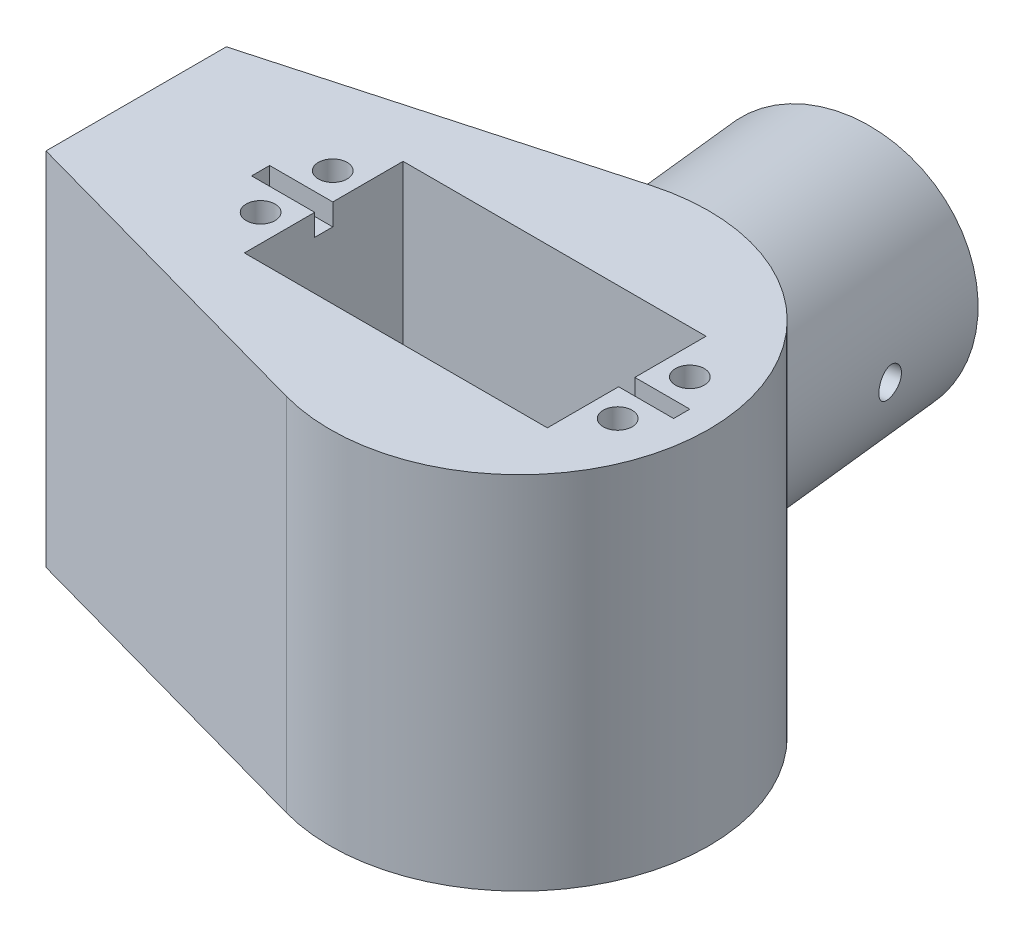
from build123d import *

# Parameters (mm, degrees)
BOSS_EXTRUDE1_DEPTH       = 40
SKETCH2_W                 = 33.6
SKETCH2_H                 = 17.6
CUT_EXTRUDE1_DEPTH        = 20
SKETCH3_W                 = 7
SKETCH3_H                 = 2
CUT_EXTRUDE2_DEPTH        = 2.4
SKETCH4_W                 = 7
SKETCH4_H                 = 1.8
CUT_EXTRUDE3_DEPTH        = 2.4
REVOLVE1_START            = -44.95139953
REVOLVE1_OUTLINE_R        = 13.5
REVOLVE1_DEPTH            = 30.829897511
M18_CLEARANCE_HOLE1_D     = 20
M18_CLEARANCE_HOLE1_DEPTH = 25
SKETCH9_W                 = 1.6
SKETCH9_H                 = 27
CUT_EXTRUDE4_DEPTH        = 76.299241718
CUT_EXTRUDE4_DEPTH_BACK   = 76.299241718
SKETCH18_R                = 1.6
SCALE2_SCALE              = 1.25
SKETCH20_R                = 9.5
CUT_EXTRUDE5_DEPTH        = 5
SKETCH21_R                = 6
CUT_EXTRUDE6_DEPTH        = 87.235197147
CUT_EXTRUDE8_START        = -6
SKETCH25_R                = 9.5
CUT_EXTRUDE8_DEPTH        = 6
SKETCH27_R                = 2
CUT_EXTRUDE9_DEPTH        = 12


with BuildPart() as part:
    # Sketch1 → Boss-Extrude1 (new body)
    with BuildSketch(Plane(origin=(0, 40, 0), x_dir=(1, 0, 0), z_dir=(0, 1, 0))):
        with BuildLine():
            Line((-5.61521172, 20.235350191), (-42.5, 10))
            Line((-42.5, 10), (-42.5, -10))
            Line((-42.5, -10), (-5.61521172, -20.235350191))
            ThreePointArc((-5.61521172, -20.235350191), (21, 0), (-5.61521172, 20.235350191))
        make_face()
    extrude(amount=-BOSS_EXTRUDE1_DEPTH)

    # Sketch2 → Cut-Extrude1 (cut)
    with BuildSketch(Plane(origin=(0, 40, 0), x_dir=(-1, 0, 0), z_dir=(0, 1, 0))):
        with Locations((4.9, 0)):
            Rectangle(SKETCH2_W, SKETCH2_H)
    extrude(amount=-CUT_EXTRUDE1_DEPTH, mode=Mode.SUBTRACT)

    # Sketch3 → Cut-Extrude2 (cut)
    with BuildSketch(Plane(origin=(0, 40, 0), x_dir=(-1, 0, 0), z_dir=(0, 1, 0))):
        with Locations((25.2, 0)):
            Rectangle(SKETCH3_W, SKETCH3_H)
    extrude(amount=-CUT_EXTRUDE2_DEPTH, mode=Mode.SUBTRACT)

    # Sketch4 → Cut-Extrude3 (cut)
    with BuildSketch(Plane(origin=(0, 40, 0), x_dir=(-1, 0, 0), z_dir=(0, 1, 0))):
        with Locations((-14.5, 0)):
            Rectangle(SKETCH4_W, SKETCH4_H)
    extrude(amount=-CUT_EXTRUDE3_DEPTH, mode=Mode.SUBTRACT)

    # Revolve1: read off the stored shape, not the designer's step
    # Revolve1 outline → Revolve1 (add)
    with BuildSketch(Plane(origin=(0, 0, 0), x_dir=(0.9799247046208294, -0.02083962380947531, -0.19827577601224947), z_dir=(0.19936793441719802, 0.10243002349202102, 0.9745565745577031)).offset(REVOLVE1_START)):
        with Locations((-1.9070974, 22.005607966)):
            Circle(REVOLVE1_OUTLINE_R)
    extrude(amount=REVOLVE1_DEPTH)

    # M18 Clearance Hole1
    with Locations(Plane(origin=(-8.961867673, -4.60437291, -43.807681948), x_dir=(-0.9799247046208296, 0.02083962380947534, 0.19827577601224922), z_dir=(-0.19936793441719777, -0.10243002349202121, -0.9745565745577032))):
        with Locations((1.9070974, 22.005607966)):
            Hole(M18_CLEARANCE_HOLE1_D / 2, depth=M18_CLEARANCE_HOLE1_DEPTH)

    # Sketch9 → M3.5 Clearance Hole1 (revolve, cut)
    with BuildSketch(Plane(origin=(-18.009225855, 18.806465846, -31.591069121), x_dir=(-0.12392681772022805, 0.7153744254872676, -0.6876638533531477), z_dir=(0.1561720753640579, 0.6984304843277114, 0.6984304843277114))):
        with Locations((0.8, 13.5)):
            Rectangle(SKETCH9_W, SKETCH9_H)
    revolve(axis=Axis((-11.78670398, 18.674134235, -32.850120299), (-0.9799247046208297, 0.020839623809475325, 0.19827577601224802)), mode=Mode.SUBTRACT)

    # Sketch18 → Cut-Extrude4 (cut, two sides: drawn at the far end of the back side and taken through both)
    with BuildSketch(Plane(origin=(-1.740210315, 0.03700828, 0.352110268), x_dir=(-0.19823095447813932, 0.004215689735382395, -0.9801462730872066), z_dir=(0.9799247046208297, -0.020839623809475356, -0.19827577601224802)).offset(-CUT_EXTRUDE4_DEPTH_BACK)):
        with Locations(Location((34.613136918, 18.419306886, 0), (0, 0, 359.758405588))):
            Circle(SKETCH18_R)
    extrude(amount=CUT_EXTRUDE4_DEPTH + CUT_EXTRUDE4_DEPTH_BACK, mode=Mode.SUBTRACT)


with BuildPart() as part_1:
    # Scale2: scaled about (0, 0, 0)
    add(part.part.scale(SCALE2_SCALE))

    # Sketch20 → Cut-Extrude5 (cut)
    with BuildSketch(Plane(origin=(0, 25, 0), x_dir=(1, 0, 0), z_dir=(0, 1, 0))):
        with Locations(Location((3.875, 0, 0), (0, 0, 270))):
            Circle(SKETCH20_R)
    extrude(amount=-CUT_EXTRUDE5_DEPTH, mode=Mode.SUBTRACT)

    # Sketch21 → Cut-Extrude6 (cut, through all)
    with BuildSketch(Plane(origin=(0, 20, 0), x_dir=(1, 0, 0), z_dir=(0, 1, 0))):
        with Locations(Location((3.875, 0, 0), (0, 0, 270))):
            Circle(SKETCH21_R)
    extrude(amount=-CUT_EXTRUDE6_DEPTH, mode=Mode.SUBTRACT)

    # Sketch25 → Cut-Extrude8 (cut)
    with BuildSketch(Plane.XZ.offset(CUT_EXTRUDE8_START)):
        with Locations(Location((3.875, 0, 0), (0, 0, 90))):
            Circle(SKETCH25_R)
    extrude(amount=CUT_EXTRUDE8_DEPTH, mode=Mode.SUBTRACT)

    # Sketch27 → Cut-Extrude9 (cut)
    with BuildSketch(Plane(origin=(0, 50, 0), x_dir=(1, 0, 0), z_dir=(0, 1, 0))):
        with Locations(Location((18.625, 5, 0), (0, 0, 270))):
            Circle(SKETCH27_R)
        with Locations(Location((18.625, -5, 0), (0, 0, 270))):
            Circle(SKETCH27_R)
        with Locations(Location((-30.875, 5, 0), (0, 0, 270))):
            Circle(SKETCH27_R)
        with Locations(Location((-30.875, -5, 0), (0, 0, 270))):
            Circle(SKETCH27_R)
    extrude(amount=-CUT_EXTRUDE9_DEPTH, mode=Mode.SUBTRACT)


solid = part_1.part
